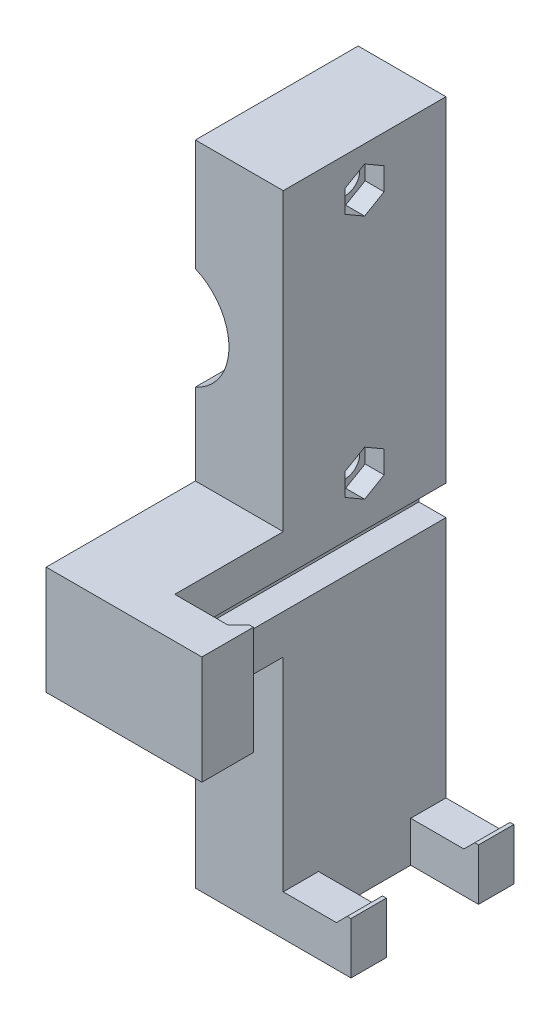
from build123d import *

# Parameters (mm, degrees)
BOSS_EXTRU_1_DEPTH      = 30
ESQUISSE3_R             = 2.6
ENL_V_MAT_EXTRU_1_DEPTH = 30
ENL_V_MAT_EXTRU_2_DEPTH = 3.5
ESQUISSE6_W             = 16.189542707
ESQUISSE6_H             = 20
BOSS_EXTRU_2_DEPTH      = 27.5
ESQUISSE7_W             = 7.5
ESQUISSE7_H             = 20
BOSS_EXTRU_3_DEPTH      = 12.5
ESQUISSE9_W             = 45
ESQUISSE9_H             = 5.5
ESQUISSE9_R             = 1
ENL_V_MAT_EXTRU_4_DEPTH = 5
ESQUISSE10_R            = 1.5
BOSS_EXTRU_4_DEPTH      = 1.4
CHANFREIN1_SIZE         = 1
ENL_V_MAT_EXTRU_5_DEPTH = 25
ESQUISSE12_W            = 2.7
ESQUISSE12_H            = 20
BOSS_EXTRU_5_DEPTH      = 2
CHANFREIN2_SIZE         = 2
ESQUISSE13_W            = 2.7
ESQUISSE13_H            = 30
BOSS_EXTRU_6_DEPTH      = 2
CHANFREIN3_SIZE         = 2
ENL_V_START             = -12.5
ESQUISSE15_W            = 17
ESQUISSE15_H            = 9.5
ENL_V_MAT_EXTRU_6_DEPTH = 12.5


# Some blends are built 0.0001 mm under size
with BuildPart() as part:
    # Esquisse1 → Boss.-Extru.1 (new body)
    with BuildSketch(Plane.XY):
        with BuildLine():
            Line((4.110457293, 9.444264971), (4.110457293, 30))
            Line((4.110457293, 30), (20.3, 30))
            Line((20.3, 30), (20.3, -81.944264971))
            Line((20.3, -81.944264971), (32.8, -81.944264971))
            Line((32.8, -81.944264971), (32.8, -89.444264971))
            Line((32.8, -89.444264971), (4.110457293, -89.444264971))
            Line((4.110457293, -89.444264971), (4.110457293, -9.444264971))
            ThreePointArc((4.110457293, -9.444264971), (10.3, 0), (4.110457293, 9.444264971))
        make_face()
    extrude(amount=BOSS_EXTRU_1_DEPTH)

    # Esquisse3 → Enlèv. mat.-Extru.1 (cut)
    with BuildSketch(Plane.ZY.offset(-4.110457293)):
        with Locations(Location((15, 22.6, 0), (0, 0, 270))):
            Circle(ESQUISSE3_R)
        with Locations(Location((15, -22.6, 0), (0, 0, 270))):
            Circle(ESQUISSE3_R)
    extrude(amount=-ENL_V_MAT_EXTRU_1_DEPTH, mode=Mode.SUBTRACT)

    # Esquisse4 → Enlèv. mat.-Extru.2 (cut)
    with BuildSketch(Plane(origin=(20.3, 0, 0), x_dir=(0, 0, -1), z_dir=(1, 0, 0))):
        Polygon((-15, -18.443078062), (-18.6, -20.521539031), (-18.6, -24.678460969), (-15, -26.756921938), (-11.4, -24.678460969), (-11.4, -20.521539031), align=None)
        Polygon((-15, 26.756921938), (-18.6, 24.678460969), (-18.6, 20.521539031), (-15, 18.443078062), (-11.4, 20.521539031), (-11.4, 24.678460969), align=None)
    extrude(amount=-ENL_V_MAT_EXTRU_2_DEPTH, mode=Mode.SUBTRACT)

    # Esquisse6 → Boss.-Extru.2 (add)
    with BuildSketch(Plane.XY.offset(30)):
        with Locations((12.205228647, -34.444264971)):
            Rectangle(ESQUISSE6_W, ESQUISSE6_H)
    extrude(amount=BOSS_EXTRU_2_DEPTH)

    # Esquisse7 → Boss.-Extru.3 (add)
    with BuildSketch(Plane(origin=(20.3, 0, 0), x_dir=(0, 0, -1), z_dir=(1, 0, 0))):
        with Locations((-53.75, -34.444264971)):
            Rectangle(ESQUISSE7_W, ESQUISSE7_H)
    extrude(amount=BOSS_EXTRU_3_DEPTH)

    # Esquisse9 → Enlèv. mat.-Extru.4 (cut)
    with BuildSketch(Plane(origin=(20.3, 0, 0), x_dir=(0, 0, -1), z_dir=(1, 0, 0))):
        with Locations((-22.5, -34.444264971)):
            Rectangle(ESQUISSE9_W, ESQUISSE9_H)
        with Locations((-43, -34.444264971)):
            Circle(ESQUISSE9_R, mode=Mode.SUBTRACT)
    extrude(amount=-ENL_V_MAT_EXTRU_4_DEPTH, mode=Mode.SUBTRACT)

    # Esquisse10 → Boss.-Extru.4 (add)
    with BuildSketch(Plane(origin=(20.3, 0, 0), x_dir=(0, 0, -1), z_dir=(1, 0, 0))):
        with Locations((-43, -34.444264971)):
            Circle(ESQUISSE10_R)
    extrude(amount=-BOSS_EXTRU_4_DEPTH)

    # Chanfrein1
    # the kernel refuses this chamfer: 1 mm, written as the material it takes off along each edge
    with BuildSketch(Plane(origin=(18.9, -34.444264971, 43), x_dir=(0, 0, -1), z_dir=(0, -1, 0))) as chanfrein1_piece_1_section:
        Polygon((1.5 - CHANFREIN1_SIZE, 0), (1.5, CHANFREIN1_SIZE), (1.5, 0), align=None)
    chanfrein1_piece_1 = revolve(axis=Axis((18.9, -34.444264971, 43), (1, 0, 0)), mode=Mode.PRIVATE)
    chanfrein1_piece_1 = chanfrein1_piece_1 - Plane(origin=(19.653593842, -34.444264971, 43), x_dir=(0, 0, -1), z_dir=(1, 0, 0)) * Cylinder(1, 7, mode=Mode.PRIVATE)
    add(chanfrein1_piece_1, mode=Mode.SUBTRACT)

    # Esquisse11 → Enlèv. mat.-Extru.5 (cut)
    with BuildSketch(Plane(origin=(0, 0, 0), x_dir=(-1, 0, 0), z_dir=(0, 0, -1))):
        Polygon((-12.110457293, -32.694264971), (-7.110457293, -32.694264971), (-4.850170078, -34.444264971), (-7.110457293, -36.194264971), (-12.110457293, -36.194264971), (-14.370744508, -34.444264971), align=None)
    extrude(amount=-ENL_V_MAT_EXTRU_5_DEPTH, mode=Mode.SUBTRACT)

    # Esquisse12 → Boss.-Extru.5 (add)
    with BuildSketch(Plane(origin=(0, 0, 50), x_dir=(-1, 0, 0), z_dir=(0, 0, -1))):
        with Locations((-31.45, -34.444264971)):
            Rectangle(ESQUISSE12_W, ESQUISSE12_H)
    extrude(amount=BOSS_EXTRU_5_DEPTH)

    # Chanfrein2
    chanfrein2_edges = [part.edges().sort_by_distance(p)[0] for p in [
        (30.1, -34.444264971, 48),
    ]]
    chamfer(chanfrein2_edges, length=CHANFREIN2_SIZE - 0.0001)  # a hair under: the kernel refuses the full size

    # Esquisse13 → Boss.-Extru.6 (add)
    with BuildSketch(Plane(origin=(0, -81.944264971, 0), x_dir=(1, 0, 0), z_dir=(0, 1, 0))):
        with Locations((31.45, -15)):
            Rectangle(ESQUISSE13_W, ESQUISSE13_H)
    extrude(amount=BOSS_EXTRU_6_DEPTH)

    # Chanfrein3
    chanfrein3_edges = [part.edges().sort_by_distance(p)[0] for p in [
        (30.1, -79.944264971, 15),
    ]]
    chamfer(chanfrein3_edges, length=CHANFREIN3_SIZE - 0.0001)  # a hair under: the kernel refuses the full size

    # Esquisse15 → Enlèv. mat.-Extru.6 (cut)
    with BuildSketch(Plane(origin=(32.8, 0, 0), x_dir=(0, 0, -1), z_dir=(1, 0, 0)).offset(ENL_V_START)):
        with Locations((-15, -84.694264971)):
            Rectangle(ESQUISSE15_W, ESQUISSE15_H)
    extrude(amount=ENL_V_MAT_EXTRU_6_DEPTH, mode=Mode.SUBTRACT)


solid = part.part
